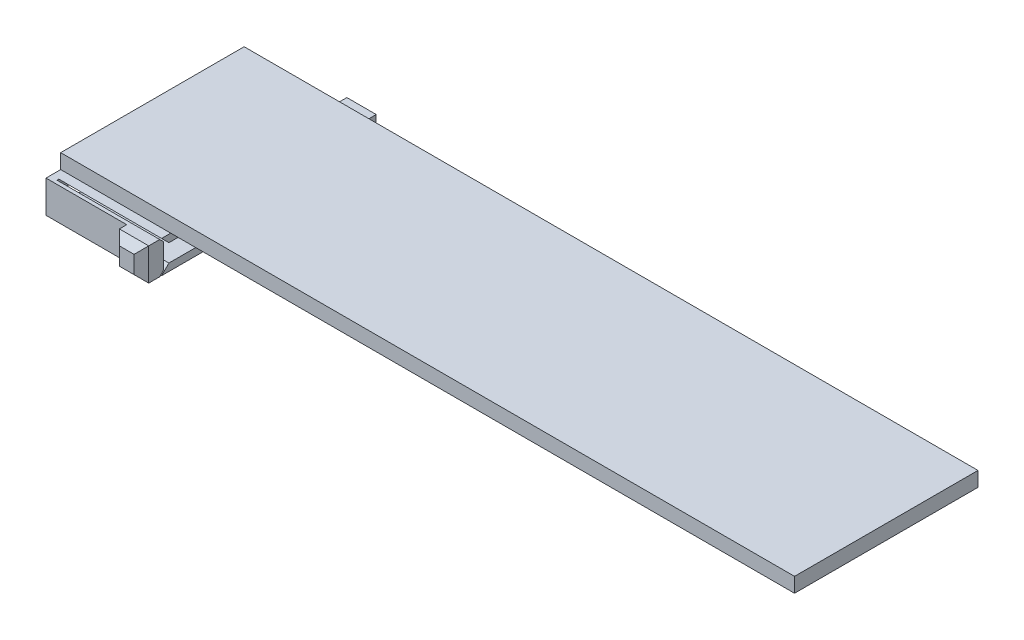
from build123d import *

# Parameters (mm, degrees)
BOSS_EXTRUDE1_DEPTH = 29
CUT_EXTRUDE1_REACH  = 35.231
SKETCH3_W           = 4.5
SKETCH3_H           = 1.5
CUT_EXTRUDE2_REACH  = 35.231
SKETCH4_W           = 25
SKETCH4_H           = 2.4
FILLET1_R           = 1
CHAMFER1_SIZE       = 1.75
BOSS_EXTRUDE2_DEPTH = 14
SKETCH6_W           = 2
SKETCH6_H           = 4.4
BOSS_EXTRUDE3_DEPTH = 4
CHAMFER2_SIZE       = 1
SKETCH7_W           = 100
SKETCH7_H           = 25
BOSS_EXTRUDE4_DEPTH = 2


# Some blends are built 0.0001 mm under size
with BuildPart() as part:
    # Sketch2 → Boss-Extrude1 (new body)
    with BuildSketch(Plane.XY):
        Polygon((6.559345521, 5.191043118), (9.559345521, 3.691043118), (9.559345521, 5.191043118), (9.559345521, 6.191043118), (-5.440654479, 6.191043118), (-5.440654479, 1.791043118), (9.559345521, 1.791043118), (9.559345521, 2.791043118), (-4.440654479, 2.791043118), (-4.440654479, 5.191043118), align=None)
    extrude(amount=-BOSS_EXTRUDE1_DEPTH)

    # Sketch3 → Cut-Extrude1 (cut, up to next)
    with BuildSketch(Plane(origin=(9.559345521, 0, 0), x_dir=(0, 0, -1), z_dir=(1, 0, 0)), mode=Mode.PRIVATE) as cut_extrude1_sk1:
        with Locations((2.25, 4.441043118)):
            Rectangle(SKETCH3_W, SKETCH3_H)
    cut_extrude1_tool1 = extrude(cut_extrude1_sk1.sketch, amount=-CUT_EXTRUDE1_REACH, mode=Mode.PRIVATE) & part.part
    # Sketch3 → Cut-Extrude1 (cut, up to next)
    with BuildSketch(Plane(origin=(9.559345521, 0, 0), x_dir=(0, 0, -1), z_dir=(1, 0, 0)), mode=Mode.PRIVATE) as cut_extrude1_sk2:
        with Locations((26.75, 4.441043118)):
            Rectangle(SKETCH3_W, SKETCH3_H)
    cut_extrude1_tool2 = extrude(cut_extrude1_sk2.sketch, amount=-CUT_EXTRUDE1_REACH, mode=Mode.PRIVATE) & part.part
    add(cut_extrude1_tool1.solids().sort_by_distance((9.559346, 4.441043, -2.25))[0], mode=Mode.SUBTRACT)
    add(cut_extrude1_tool2.solids().sort_by_distance((9.559346, 4.441043, -26.75))[0], mode=Mode.SUBTRACT)

    # Sketch4 → Cut-Extrude2 (cut, up to next)
    with BuildSketch(Plane.ZY.offset(5.440654479), mode=Mode.PRIVATE) as cut_extrude2_sk1:
        with Locations((-14.5, 3.991043118)):
            Rectangle(SKETCH4_W, SKETCH4_H)
    cut_extrude2_tool1 = extrude(cut_extrude2_sk1.sketch, amount=-CUT_EXTRUDE2_REACH, mode=Mode.PRIVATE) & part.part
    add(cut_extrude2_tool1.solids().sort_by_distance((-5.440654, 3.991043, -14.5))[0], mode=Mode.SUBTRACT)

    # Fillet1
    fillet1_edges = [part.edges().sort_by_distance(p)[0] for p in [
        (-5.440654479, 3.991043118, -2),
        (-5.440654479, 2.791043118, -14.5),
        (-5.440654479, 3.991043118, -27),
        (-5.440654479, 5.191043118, -14.5),
    ]]
    fillet(fillet1_edges, radius=FILLET1_R - 0.0001)  # a hair under: the kernel refuses the full size

    # Chamfer1
    # the kernel refuses this chamfer: 1.75 mm, written as the material it takes off along each edge
    with BuildSketch(Plane(origin=(14.05979075, 2.791043118, -29), x_dir=(0, -0.9996219169112968, -0.02749587661058612), z_dir=(-1, 0, 0))) as chamfer1_piece_1:
        Polygon((CHAMFER1_SIZE * 0.999621916911, CHAMFER1_SIZE * 0.0274958766106), (-CHAMFER1_SIZE * 0.0274958766106, CHAMFER1_SIZE * 0.999621916911), (0, 0), align=None)
    extrude(amount=18.500445229, mode=Mode.SUBTRACT)
    with BuildSketch(Plane(origin=(-4.440654479, 5.191043118, -29), x_dir=(0, -0.02749587661058662, 0.9996219169112968), z_dir=(1, 0, 0)), Plane(origin=(14.05979075, 5.191043118, 0), x_dir=(0, -0.02749587661058661, -0.9996219169112968), z_dir=(-1, 0, 0)), Plane(origin=(14.05979075, 2.791043118, 0), x_dir=(0, -0.9996219169112968, 0.027495876610586382), z_dir=(-1, 0, 0))) as chamfer1_piece_2:
        Polygon((CHAMFER1_SIZE * 0.999621916911, -CHAMFER1_SIZE * 0.0274958766106), (-CHAMFER1_SIZE * 0.0274958766106, -CHAMFER1_SIZE * 0.999621916911), (0, 0), align=None)
    extrude(amount=18.500445229, mode=Mode.SUBTRACT)

    # Sketch5 → Boss-Extrude2 (add)
    with BuildSketch(Plane(origin=(-4.440654479, 0, 0), x_dir=(0, 0, -1), z_dir=(1, 0, 0))):
        Polygon((0, 1.791043118), (0, 6.191043118), (0.5, 6.191043118), (1, 5.691043118), (1, 2.291043118), (0.5, 1.791043118), align=None)
        Polygon((28, 2.291043118), (28.5, 1.791043118), (29, 1.791043118), (29, 6.191043118), (28.5, 6.191043118), (28, 5.691043118), align=None)
    extrude(amount=BOSS_EXTRUDE2_DEPTH)

    # Sketch6 → Boss-Extrude3 (add)
    with BuildSketch(Plane(origin=(9.559345521, 0, 0), x_dir=(0, 0, -1), z_dir=(1, 0, 0))):
        with Locations((-1, 3.991043118)):
            Rectangle(SKETCH6_W, SKETCH6_H)
        with Locations((30, 3.991043118)):
            Rectangle(SKETCH6_W, SKETCH6_H)
    extrude(amount=-BOSS_EXTRUDE3_DEPTH)

    # Chamfer2
    chamfer2_edges = [part.edges().sort_by_distance(p)[0] for p in [
        (5.559345521, 3.991043118, 2),
        (7.559345521, 1.791043118, 2),
        (7.559345521, 6.191043118, 2),
        (9.559345521, 3.991043118, 2),
        (5.559345521, 3.991043118, -31),
        (7.559345521, 6.191043118, -31),
        (7.559345521, 1.791043118, -31),
        (9.559345521, 3.991043118, -31),
    ]]
    chamfer(chamfer2_edges, length=CHAMFER2_SIZE)

    # Sketch7 → Boss-Extrude4 (add)
    with BuildSketch(Plane(origin=(0, 6.191043118, 0), x_dir=(1, 0, 0), z_dir=(0, 1, 0))):
        with Locations((44.559345521, 14.5)):
            Rectangle(SKETCH7_W, SKETCH7_H)
    extrude(amount=BOSS_EXTRUDE4_DEPTH)


solid = part.part
